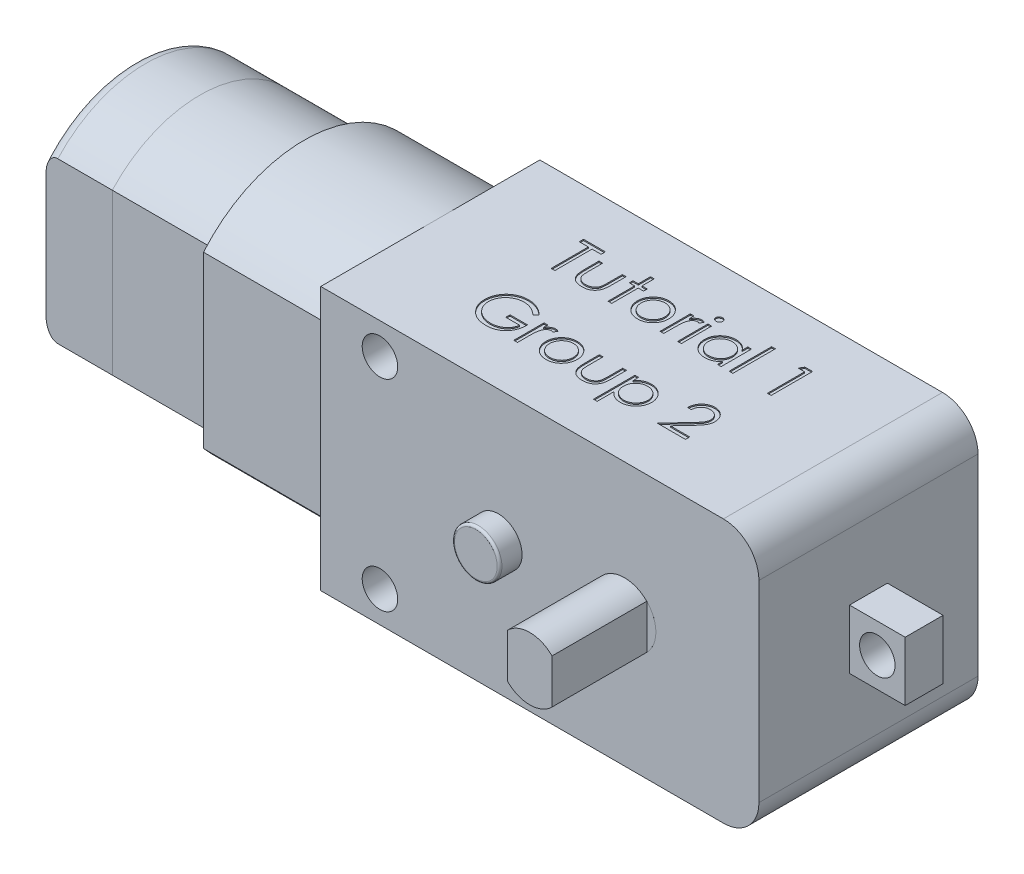
from build123d import *

# Parameters (mm, degrees)
BOSS_EXTRUDE1_DEPTH              = 9.25
BOSS_EXTRUDE1_DEPTH_BACK         = 9.25
BOSS_EXTRUDE2_DEPTH              = 11.4
SKETCH3_W                        = 3.2
SKETCH3_H                        = 5
BOSS_EXTRUDE3_DEPTH              = 4.7
CUT_EXTRUDE1_DEPTH               = 28
CUT_EXTRUDE1_DEPTH_BACK          = 17.7
SKETCH4_R                        = 1.5
SKETCH5_R                        = 2
BOSS_EXTRUDE4_DEPTH              = 1.9
FILLET1_R                        = 0.2
SKETCH6_R                        = 2.65
CUT_EXTRUDE2_DEPTH               = 23.9
BOSS_EXTRUDE5_DEPTH              = 8.8
BOSS_EXTRUDE6_DEPTH              = 5.6
FILLET2_R                        = 1
BOSS_EXTRUDE7_DEPTH              = 1
SKETCH12_R                       = 1
BOSS_EXTRUDE8_DEPTH              = 0.5
SKETCH14_R                       = 1.5
CUT_EXTRUDE3_DEPTH               = 4.2
BOSS_EXTRUDE10_DEPTH             = 17.25
BOSS_EXTRUDE10_DEPTH_BACK        = 17.25
BOSS_EXTRUDE11_REACH             = 52.189
SKETCH16_R                       = 2.65
BOSS_EXTRUDE11_DIRECTION_2_REACH = 52.189
SKETCH19_W                       = 0.314102565
SKETCH19_H                       = 2.557692308
SKETCH19_W_2                     = 0.314102564
SKETCH19_H_2                     = 3.58974359
CUT_EXTRUDE4_DEPTH               = 0.1


with BuildPart() as part:
    # Sketch 1 → Boss-Extrude1 (new, two sides: drawn at the far end of the back side and taken through both)
    with BuildSketch(Plane.XY.offset(-BOSS_EXTRUDE1_DEPTH_BACK)):
        with BuildLine():
            Line((-18.5, -11.125), (15.5, -11.125))
            ThreePointArc((15.5, -11.125), (17.621320344, -10.246320344), (18.5, -8.125))
            Line((18.5, -8.125), (18.5, 8.125))
            ThreePointArc((18.5, 8.125), (17.621320344, 10.246320344), (15.5, 11.125))
            Line((15.5, 11.125), (-18.5, 11.125))
            Line((-18.5, 11.125), (-18.5, -11.125))
        make_face()
    extrude(amount=BOSS_EXTRUDE1_DEPTH + BOSS_EXTRUDE1_DEPTH_BACK)

    # Sketch2 → Boss-Extrude2 (add)
    with BuildSketch(Plane.ZY.offset(18.5)):
        with BuildLine():
            Line((7.75, -7.17743861), (7.75, 7.17743861))
            ThreePointArc((7.75, 7.17743861), (-0.75, 11.125), (-9.25, 7.17743861))
            Line((-9.25, 7.17743861), (-9.25, -7.17743861))
            ThreePointArc((-9.25, -7.17743861), (-0.75, -11.125), (7.75, -7.17743861))
        make_face()
    extrude(amount=BOSS_EXTRUDE2_DEPTH)

    # Sketch3 → Boss-Extrude3 (add)
    with BuildSketch(Plane(origin=(18.5, 0, 0), x_dir=(0, 0, -1), z_dir=(1, 0, 0))):
        Rectangle(SKETCH3_W, SKETCH3_H)
    extrude(amount=BOSS_EXTRUDE3_DEPTH)

    # Sketch4 → Cut-Extrude1 (cut, two sides: drawn at the far end of the back side and taken through both)
    with BuildSketch(Plane.XY.offset(-CUT_EXTRUDE1_DEPTH_BACK)):
        with Locations((-13.5, 8.5)):
            Circle(SKETCH4_R)
        with Locations((-13.5, -8.5)):
            Circle(SKETCH4_R)
    extrude(amount=CUT_EXTRUDE1_DEPTH + CUT_EXTRUDE1_DEPTH_BACK, mode=Mode.SUBTRACT)

    # Sketch5 → Boss-Extrude4 (add)
    with BuildSketch(Plane.XY.offset(9.25)):
        with Locations((-3.5, 0)):
            Circle(SKETCH5_R)
    extrude(amount=BOSS_EXTRUDE4_DEPTH)

    # Fillet1
    fillet1_edges = [part.edges().sort_by_distance(p)[0] for p in [
        (-5.5, 0, 11.15),
    ]]
    fillet(fillet1_edges, radius=FILLET1_R)

    # Sketch6 → Cut-Extrude2 (cut)
    with BuildSketch(Plane.XY.offset(9.25)):
        with Locations((7.15, 0)):
            Circle(SKETCH6_R)
    extrude(amount=-CUT_EXTRUDE2_DEPTH, mode=Mode.SUBTRACT)

    # Sketch14 → Cut-Extrude3 (cut)
    with BuildSketch(Plane.XY.offset(1.6)):
        with Locations((20.85, 0)):
            Circle(SKETCH14_R)
    extrude(amount=-CUT_EXTRUDE3_DEPTH, mode=Mode.SUBTRACT)


with BuildPart() as body_2:
    # Sketch9 → Boss-Extrude5 (new body)
    with BuildSketch(Plane.ZY.offset(29.9)):
        with BuildLine():
            Line((6.65, -6.763181574), (6.65, 6.763181574))
            ThreePointArc((6.65, 6.763181574), (-0.75, 10.025), (-8.15, 6.763181574))
            Line((-8.15, 6.763181574), (-8.15, -6.763181574))
            ThreePointArc((-8.15, -6.763181574), (-0.75, -10.025), (6.65, -6.763181574))
        make_face()
    extrude(amount=BOSS_EXTRUDE5_DEPTH)


with BuildPart() as body_3:
    # Sketch10 → Boss-Extrude6 (new body)
    with BuildSketch(Plane.ZY.offset(38.7)):
        with BuildLine():
            Line((-8.15, 6.763181574), (-8.15, -6.763181574))
            ThreePointArc((-8.15, -6.763181574), (-0.75, -10.025), (6.65, -6.763181574))
            Line((6.65, -6.763181574), (6.65, 6.763181574))
            ThreePointArc((6.65, 6.763181574), (-0.75, 10.025), (-8.15, 6.763181574))
        make_face()
    extrude(amount=BOSS_EXTRUDE6_DEPTH)

    # Fillet2
    fillet2_edges = [body_3.edges().sort_by_distance(p)[0] for p in [
        (-44.3, 10.025, -0.75),
        (-44.3, -10.025, -0.75),
    ]]
    fillet(fillet2_edges, radius=FILLET2_R)


with BuildPart() as body_4:
    # Sketch11 → Boss-Extrude7 (new body)
    with BuildSketch(Plane.ZY.offset(44.3)):
        with BuildLine():
            Line((2.65, 3.666060556), (2.65, -3.666060556))
            ThreePointArc((2.65, -3.666060556), (-5.75, 0), (2.65, 3.666060556))
        make_face()
    extrude(amount=BOSS_EXTRUDE7_DEPTH)


with BuildPart() as body_5:
    # Sketch12 → Boss-Extrude8 (new body)
    with BuildSketch(Plane.ZY.offset(45.3)):
        with Locations((-0.75, 0)):
            Circle(SKETCH12_R)
    extrude(amount=BOSS_EXTRUDE8_DEPTH)


with BuildPart() as body_6:
    # Sketch15 → Boss-Extrude10 (new, two sides: drawn at the far end of the back side and taken through both)
    with BuildSketch(Plane.XY.offset(-BOSS_EXTRUDE10_DEPTH_BACK)):
        with BuildLine():
            Line((9.03, -1.867645577), (9.03, 1.867645577))
            ThreePointArc((9.03, 1.867645577), (7.15, 2.65), (5.27, 1.867645577))
            Line((5.27, 1.867645577), (5.27, -1.867645577))
            ThreePointArc((5.27, -1.867645577), (7.15, -2.65), (9.03, -1.867645577))
        make_face()
    extrude(amount=BOSS_EXTRUDE10_DEPTH + BOSS_EXTRUDE10_DEPTH_BACK)


with BuildPart() as body_7:

    # Boss-Extrude11: up to this face of the body (flat: up to its plane)
    boss_extrude11_end = Plane(part.part.faces().sort_by_distance((0.010664145, 0, 9.25))[0])
    # Sketch16 → Boss-Extrude11 (new, up to the picked face)
    with BuildSketch(Plane.XY, mode=Mode.PRIVATE) as boss_extrude11_sk1:
        with Locations((7.15, 0)):
            Circle(SKETCH16_R)
    boss_extrude11_tool1 = split(extrude(boss_extrude11_sk1.sketch, amount=BOSS_EXTRUDE11_REACH, mode=Mode.PRIVATE), bisect_by=boss_extrude11_end, keep=Keep.BOTH, mode=Mode.PRIVATE)
    add(boss_extrude11_tool1.solids().sort_by(Axis((7.15, 0, 0), (0, 0, 1)))[0])


    # Boss-Extrude11 direction 2: up to this face of the body (flat: up to its plane)
    boss_extrude11_direction_2_end = Plane(part.part.faces().sort_by_distance((-4.220368924, 0, -9.25))[0])
    # Sketch16 → Boss-Extrude11 direction 2 (add, up to the picked face)
    with BuildSketch(Plane.XY, mode=Mode.PRIVATE) as boss_extrude11_direction_2_sk1:
        with Locations((7.15, 0)):
            Circle(SKETCH16_R)
    boss_extrude11_direction_2_tool1 = split(extrude(boss_extrude11_direction_2_sk1.sketch, amount=-BOSS_EXTRUDE11_DIRECTION_2_REACH, mode=Mode.PRIVATE), bisect_by=boss_extrude11_direction_2_end, keep=Keep.BOTH, mode=Mode.PRIVATE)
    add(boss_extrude11_direction_2_tool1.solids().sort_by(Axis((7.15, 0, 0), (0, 0, -1)))[0])


with BuildPart() as part_1:
    add(part.part)

    # Sketch19 → Cut-Extrude4 (cut)
    # profile 1 of 16: a face of its own
    with BuildSketch(Plane(origin=(0, 11.125, 0), x_dir=(1, 0, 0), z_dir=(0, 1, 0))):
        Polygon((-10.853713796, 4.936962188), (-10.853713796, 5.295936547), (-9.013970206, 5.295936547), (-9.013970206, 4.936962188), (-9.776790719, 4.936962188), (-9.776790719, 1.795936547), (-10.090893283, 1.795936547), (-10.090893283, 4.936962188), align=None)
    # profile 2 of 16: a face of its own
    with BuildSketch(Plane(origin=(0, 11.125, 0), x_dir=(1, 0, 0), z_dir=(0, 1, 0))):
        with BuildLine():
            Line((-8.610124052, 4.353628855), (-8.296021488, 4.353628855))
            Line((-8.296021488, 4.353628855), (-8.296021488, 3.167330778))
            add(Edge.make_bspline(
                [(-8.296021488, 3.167330778), (-8.295879583, 3.132508029), (-8.295608126, 3.065893741), (-8.293767185, 2.970038554), (-8.289437091, 2.882621842), (-8.284023267, 2.803593105), (-8.277061131, 2.732965713), (-8.26877777, 2.670986356), (-8.259519349, 2.616952172), (-8.250456635, 2.584408816), (-8.246241841, 2.569273887)],
                knots=[0, 0, 0, 0, 1.388932606, 2.656963016, 3.823490214, 4.879454478, 5.816252168, 6.653371382, 7.373723809, 8, 8, 8, 8], degree=3))
            add(Edge.make_bspline(
                [(-8.246241841, 2.569273887), (-8.239480386, 2.550251016), (-8.226098045, 2.512600755), (-8.201824561, 2.45821175), (-8.171796224, 2.407836467), (-8.138936396, 2.359532395), (-8.101036989, 2.314730408), (-8.058577518, 2.273506164), (-8.012979281, 2.234302073), (-7.945224257, 2.187917281), (-7.852564991, 2.138201951), (-7.730912236, 2.095306132), (-7.59900801, 2.069670312), (-7.507843291, 2.066696057), (-7.46098543, 2.065167317)],
                knots=[0, 0, 0, 0, 0.725840625, 1.436591201, 2.137033971, 2.831655856, 3.53531722, 4.242432219, 4.957935707, 5.694543706, 7.190802206, 8.724350549, 10.316345118, 12, 12, 12, 12], degree=3))
            add(Edge.make_bspline(
                [(-7.46098543, 2.065167317), (-7.414131923, 2.066728565), (-7.323479054, 2.069749292), (-7.193024085, 2.094532831), (-7.073772671, 2.13593852), (-6.966921719, 2.193745932), (-6.872955879, 2.264487995), (-6.794651461, 2.347496803), (-6.730044206, 2.44014619), (-6.701834785, 2.509270469), (-6.687648091, 2.544033503)],
                knots=[0, 0, 0, 0, 1.157059328, 2.238695713, 3.266970494, 4.264342957, 5.228770407, 6.160125903, 7.074715775, 8, 8, 8, 8], degree=3))
            add(Edge.make_bspline(
                [(-6.687648091, 2.544033503), (-6.683453861, 2.557999801), (-6.674181442, 2.588875877), (-6.664219091, 2.641255625), (-6.655244629, 2.70372023), (-6.647581453, 2.776678438), (-6.64211629, 2.859939591), (-6.639170264, 2.953477667), (-6.635841989, 3.056999027), (-6.635791472, 3.129466786), (-6.635765078, 3.167330778)],
                knots=[0, 0, 0, 0, 0.557542046, 1.232589297, 2.036731608, 2.971723315, 4.038036528, 5.22795436, 6.551621927, 8, 8, 8, 8], degree=3))
            Line((-6.635765078, 3.167330778), (-6.635765078, 4.353628855))
            Line((-6.635765078, 4.353628855), (-6.321662514, 4.353628855))
            Line((-6.321662514, 4.353628855), (-6.321662514, 3.108436547))
            add(Edge.make_bspline(
                [(-6.321662514, 3.108436547), (-6.322104209, 3.066129376), (-6.322961157, 2.984047676), (-6.3284685, 2.864763565), (-6.337918113, 2.75360132), (-6.352260798, 2.6505021), (-6.369126473, 2.555544618), (-6.390882746, 2.468607172), (-6.416860983, 2.389957618), (-6.446166498, 2.318215841), (-6.480788366, 2.253168947), (-6.517615386, 2.19143313), (-6.560140158, 2.134540195), (-6.604910393, 2.079658058), (-6.654712048, 2.029516531), (-6.708611907, 1.982965055), (-6.765851327, 1.939292023), (-6.827700525, 1.900200744), (-6.893256588, 1.864984098), (-6.962600445, 1.83376802), (-7.036581443, 1.809065443), (-7.11424508, 1.787754777), (-7.19597186, 1.771040308), (-7.281682993, 1.759253742), (-7.371349609, 1.752028411), (-7.432459069, 1.751391366), (-7.463789918, 1.751064753)],
                knots=[0, 0, 0, 0, 1.493040784, 2.896703357, 4.213163133, 5.428574705, 6.569057535, 7.615249723, 8.588095153, 9.490268104, 10.346124644, 11.18633936, 12.024365274, 12.850166724, 13.684164916, 14.514361689, 15.362232829, 16.222528818, 17.093394965, 17.986930858, 18.902426812, 19.842810585, 20.827885679, 21.843828298, 22.894529745, 24, 24, 24, 24], degree=3))
            add(Edge.make_bspline(
                [(-7.463789918, 1.751064753), (-7.494886432, 1.75140446), (-7.555993977, 1.752072016), (-7.645665221, 1.759213824), (-7.731613827, 1.771021994), (-7.813534226, 1.787877212), (-7.891508623, 1.808916282), (-7.965852863, 1.833919817), (-8.035696426, 1.865000299), (-8.10187843, 1.899977856), (-8.163880818, 1.939543132), (-8.221989396, 1.982911171), (-8.276126249, 2.030017234), (-8.326303317, 2.080664591), (-8.371816294, 2.135481528), (-8.413232335, 2.194027088), (-8.45118904, 2.255721177), (-8.485541831, 2.321784339), (-8.515053586, 2.394356349), (-8.541108832, 2.474653446), (-8.562419471, 2.563555963), (-8.579761939, 2.660987891), (-8.593713379, 2.766482933), (-8.603399522, 2.880651348), (-8.608815352, 3.00321504), (-8.609678414, 3.08786493), (-8.610124052, 3.131573567)],
                knots=[0, 0, 0, 0, 1.083640291, 2.129454052, 3.13281866, 4.105697902, 5.042300162, 5.946461698, 6.836384745, 7.703652036, 8.553297018, 9.397182691, 10.228592656, 11.052265423, 11.879314572, 12.708807002, 13.549817954, 14.402308542, 15.300838682, 16.27712199, 17.341985831, 18.484375296, 19.725102775, 21.0496083, 22.476576903, 24, 24, 24, 24], degree=3))
            Line((-8.610124052, 3.131573567), (-8.610124052, 4.353628855))
        make_face()
    # profile 3 of 16: a face of its own
    with BuildSketch(Plane(origin=(0, 11.125, 0), x_dir=(1, 0, 0), z_dir=(0, 1, 0))):
        Polygon((-5.289611232, 5.385680137), (-4.975508668, 5.385680137), (-4.975508668, 4.353628855), (-4.526790719, 4.353628855), (-4.526790719, 4.039526291), (-4.975508668, 4.039526291), (-4.975508668, 1.795936547), (-5.289611232, 1.795936547), (-5.289611232, 4.039526291), (-5.73832918, 4.039526291), (-5.73832918, 4.353628855), (-5.289611232, 4.353628855), align=None)
    # profile 4 of 16: a face of its own
    with BuildSketch(Plane(origin=(0, 11.125, 0), x_dir=(1, 0, 0), z_dir=(0, 1, 0))):
        with BuildLine():
            add(Edge.make_bspline(
                [(-2.752952578, 4.39850065), (-2.704961305, 4.397478759), (-2.610862147, 4.39547508), (-2.473054262, 4.374060114), (-2.341509126, 4.34131275), (-2.215722934, 4.296041188), (-2.097306638, 4.235359237), (-1.984535394, 4.162949946), (-1.877718385, 4.077167353), (-1.813695356, 4.010809284), (-1.78119777, 3.977126451)],
                knots=[0, 0, 0, 0, 1.054011418, 2.066658804, 3.057071809, 4.030435133, 4.997543892, 5.974964718, 6.972108034, 8, 8, 8, 8], degree=3))
            add(Edge.make_bspline(
                [(-1.78119777, 3.977126451), (-1.753215816, 3.944912465), (-1.697793436, 3.881107923), (-1.626727717, 3.77765231), (-1.565506157, 3.67051221), (-1.516443196, 3.558264883), (-1.477758172, 3.441890212), (-1.450292476, 3.320988201), (-1.433955541, 3.195825854), (-1.431752574, 3.110822015), (-1.430636873, 3.067771483)],
                knots=[0, 0, 0, 0, 1.025258237, 2.030674902, 3.01204498, 3.988269485, 4.97094183, 5.956517959, 6.965070386, 8, 8, 8, 8], degree=3))
            add(Edge.make_bspline(
                [(-1.430636873, 3.067771483), (-1.43161821, 3.024471426), (-1.433557378, 2.938908492), (-1.451900995, 2.812889127), (-1.480432081, 2.690694304), (-1.521263919, 2.57283561), (-1.573622028, 2.458952783), (-1.637512716, 2.349543233), (-1.713384333, 2.2443911), (-1.79938833, 2.144389262), (-1.894440206, 2.052223047), (-1.997556354, 1.971894778), (-2.106710388, 1.903073253), (-2.223353741, 1.847636838), (-2.346421228, 1.803927137), (-2.476178296, 1.773227121), (-2.612423366, 1.754665437), (-2.705450588, 1.752281864), (-2.752952578, 1.751064753)],
                knots=[0, 0, 0, 0, 0.998656419, 1.973391657, 2.932242238, 3.890759089, 4.846373663, 5.82037756, 6.809684879, 7.83454468, 8.860553229, 9.859544525, 10.845671541, 11.83227036, 12.833544569, 13.85385346, 14.904124723, 16, 16, 16, 16], degree=3))
            add(Edge.make_bspline(
                [(-2.752952578, 1.751064753), (-2.800687297, 1.752285949), (-2.894178157, 1.754677723), (-3.030904139, 1.773155006), (-3.160893758, 1.803912989), (-3.284122357, 1.847780481), (-3.401267203, 1.903075025), (-3.5110537, 1.971686715), (-3.614253616, 2.05224687), (-3.7093256, 2.144382807), (-3.795324206, 2.244392763), (-3.871197214, 2.349542802), (-3.93508754, 2.458952895), (-3.987445744, 2.57283558), (-4.028277557, 2.690694312), (-4.05680865, 2.812889124), (-4.075152264, 2.938908493), (-4.077091433, 3.024471426), (-4.07807277, 3.067771483)],
                knots=[0, 0, 0, 0, 1.099876186, 2.154163076, 3.173186993, 4.173200201, 5.163417411, 6.152872554, 7.150605724, 8.17532212, 9.198891216, 10.186952605, 11.159729845, 12.11414092, 13.071450619, 14.029093627, 15.002601286, 16, 16, 16, 16], degree=3))
            add(Edge.make_bspline(
                [(-4.07807277, 3.067771483), (-4.07694946, 3.110588029), (-4.074725498, 3.195357432), (-4.058404989, 3.320284492), (-4.031046433, 3.440981881), (-3.992315036, 3.556907357), (-3.942799845, 3.668662793), (-3.882438558, 3.776067624), (-3.810647925, 3.879055425), (-3.755445973, 3.942777505), (-3.727511873, 3.975023086)],
                knots=[0, 0, 0, 0, 1.031353054, 2.041901799, 3.029428768, 4.008703097, 4.981709435, 5.96992636, 6.972712378, 8, 8, 8, 8], degree=3))
            add(Edge.make_bspline(
                [(-3.727511873, 3.975023086), (-3.695063282, 4.008998025), (-3.631247418, 4.075815721), (-3.52389869, 4.161348245), (-3.411404869, 4.235264319), (-3.291679943, 4.294740535), (-3.165997085, 4.341579052), (-3.033777842, 4.374144568), (-2.895502327, 4.395397923), (-2.800942706, 4.3974561), (-2.752952578, 4.39850065)],
                knots=[0, 0, 0, 0, 1.027980169, 2.021703884, 2.998553061, 3.971491411, 4.943284454, 5.930300938, 6.949603206, 8, 8, 8, 8], degree=3))
        make_face()
        with BuildLine():
            add(Edge.make_bspline(
                [(-2.754354821, 4.084398086), (-2.788292433, 4.083433494), (-2.855291561, 4.081529212), (-2.953911146, 4.067045307), (-3.0488513, 4.044097803), (-3.140292144, 4.011493747), (-3.227925317, 3.969394848), (-3.311834719, 3.917686487), (-3.392267159, 3.857053531), (-3.467649222, 3.787590859), (-3.536831534, 3.711711865), (-3.597309511, 3.630863506), (-3.648734617, 3.54635716), (-3.691574776, 3.458104949), (-3.723481964, 3.365212535), (-3.746654987, 3.268731903), (-3.761125227, 3.168466487), (-3.763011606, 3.100305469), (-3.763970206, 3.065668118)],
                knots=[0, 0, 0, 0, 1.021534396, 2.016698045, 2.994645724, 3.958388632, 4.93408049, 5.916473867, 6.921342795, 7.962252576, 8.998418191, 10.008913653, 10.997312074, 11.973003931, 12.956656626, 13.948281152, 14.957379055, 16, 16, 16, 16], degree=3))
            add(Edge.make_bspline(
                [(-3.763970206, 3.065668118), (-3.762363382, 3.020916091), (-3.759174138, 2.932091685), (-3.733238902, 2.801280563), (-3.689852622, 2.67569871), (-3.631265342, 2.556082324), (-3.557859123, 2.445410046), (-3.471372057, 2.346738562), (-3.372732356, 2.261552751), (-3.263115856, 2.190871905), (-3.144761538, 2.134712149), (-3.019505217, 2.094913174), (-2.888864523, 2.069041481), (-2.799583792, 2.066470007), (-2.754354821, 2.065167317)],
                knots=[0, 0, 0, 0, 1.016792936, 2.018143844, 3.017858371, 4.030088057, 5.03801393, 6.028138512, 7.003788237, 7.991172063, 8.984598303, 9.972568034, 10.972917682, 12, 12, 12, 12], degree=3))
            add(Edge.make_bspline(
                [(-2.754354821, 2.065167317), (-2.709128453, 2.066477597), (-2.619852857, 2.069064054), (-2.48939368, 2.094782873), (-2.364479708, 2.134886534), (-2.24624832, 2.190808744), (-2.136681717, 2.261821159), (-2.037332596, 2.346257536), (-1.951583984, 2.445671387), (-1.87825038, 2.556228916), (-1.818703637, 2.675513268), (-1.775520435, 2.80130374), (-1.749522849, 2.932085782), (-1.74634202, 3.020914113), (-1.744739437, 3.065668118)],
                knots=[0, 0, 0, 0, 1.02726834, 2.027799167, 3.010890988, 4.004497153, 4.992059811, 5.971914811, 6.958719428, 7.966827853, 8.981595046, 9.981490638, 10.983022906, 12, 12, 12, 12], degree=3))
            add(Edge.make_bspline(
                [(-1.744739437, 3.065668118), (-1.745697707, 3.100305676), (-1.747583436, 3.168467101), (-1.7620584, 3.268729555), (-1.78521394, 3.365221152), (-1.817185557, 3.458073155), (-1.859839571, 3.546585659), (-1.912256364, 3.630615386), (-1.97248739, 3.711991932), (-2.042504511, 3.787345573), (-2.117807888, 3.85708061), (-2.198272927, 3.917709999), (-2.282057905, 3.969167594), (-2.369436488, 4.011853835), (-2.460889055, 4.043801175), (-2.555696185, 4.067177807), (-2.653894995, 4.081468004), (-2.720654038, 4.083415145), (-2.754354821, 4.084398086)],
                knots=[0, 0, 0, 0, 1.042956736, 2.052379634, 3.044323526, 4.02829302, 5.004299113, 5.996692471, 7.007513377, 8.048758398, 9.090003419, 10.095195979, 11.07790575, 12.047570684, 13.018257071, 13.989683339, 14.985167495, 16, 16, 16, 16], degree=3))
        make_face(mode=Mode.SUBTRACT)
    # profile 5 of 16: a face of its own
    with BuildSketch(Plane(origin=(0, 11.125, 0), x_dir=(1, 0, 0), z_dir=(0, 1, 0))):
        with BuildLine():
            Line((-0.892175334, 4.353628855), (-0.57807277, 4.353628855))
            Line((-0.57807277, 4.353628855), (-0.57807277, 3.977126451))
            add(Edge.make_bspline(
                [(-0.57807277, 3.977126451), (-0.554884011, 4.01218228), (-0.510535691, 4.079226279), (-0.436822761, 4.16789558), (-0.36131943, 4.241310626), (-0.283664243, 4.299814145), (-0.203286143, 4.343627264), (-0.121949191, 4.375720299), (-0.038373721, 4.394697614), (0.017788203, 4.397231273), (0.045925627, 4.39850065)],
                knots=[0, 0, 0, 0, 1.2804753, 2.448899062, 3.506932113, 4.484331642, 5.4025378, 6.288909075, 7.142734305, 8, 8, 8, 8], degree=3))
            add(Edge.make_bspline(
                [(0.045925627, 4.39850065), (0.067751954, 4.397310123), (0.112661039, 4.394860538), (0.180643629, 4.377649713), (0.250687081, 4.35017169), (0.295829468, 4.324331468), (0.319363127, 4.310860426)],
                knots=[0, 0, 0, 0, 0.901110191, 1.854092781, 2.881294221, 4, 4, 4, 4], degree=3))
            Line((0.319363127, 4.310860426), (0.146887166, 4.038825169))
            add(Edge.make_bspline(
                [(0.146887166, 4.038825169), (0.131778145, 4.045565435), (0.10309833, 4.058359751), (0.061143764, 4.073501761), (0.022462427, 4.082417677), (-0.002181131, 4.083768394), (-0.013669725, 4.084398086)],
                knots=[0, 0, 0, 0, 1.180555205, 2.24091978, 3.179933427, 4, 4, 4, 4], degree=3))
            add(Edge.make_bspline(
                [(-0.013669725, 4.084398086), (-0.038875459, 4.082718049), (-0.090287849, 4.079291259), (-0.165772348, 4.052352451), (-0.239019554, 4.008827211), (-0.297191216, 3.9605561), (-0.342233469, 3.914008302), (-0.374373694, 3.873359899), (-0.403856441, 3.827781268), (-0.432026662, 3.778051584), (-0.457692956, 3.723321738), (-0.481647625, 3.664138525), (-0.503306488, 3.600433396), (-0.515656732, 3.556050876), (-0.521983027, 3.533316355)],
                knots=[0, 0, 0, 0, 1.125678352, 2.296057538, 3.5422874, 4.923748041, 5.663163013, 6.437101912, 7.23742474, 8.08941207, 8.991984279, 9.93940061, 10.944477711, 12, 12, 12, 12], degree=3))
            add(Edge.make_bspline(
                [(-0.521983027, 3.533316355), (-0.52671542, 3.513039182), (-0.537197312, 3.468126783), (-0.54738885, 3.392778258), (-0.557458367, 3.303754599), (-0.564554986, 3.200808007), (-0.571133028, 3.084195563), (-0.57484311, 2.953739617), (-0.577946251, 2.809306266), (-0.578029318, 2.708331913), (-0.57807277, 2.655511868)],
                knots=[0, 0, 0, 0, 0.566838948, 1.255505196, 2.06880316, 3.007127437, 4.065329342, 5.249902469, 6.561414163, 8, 8, 8, 8], degree=3))
            Line((-0.57807277, 2.655511868), (-0.57807277, 1.795936547))
            Line((-0.57807277, 1.795936547), (-0.892175334, 1.795936547))
            Line((-0.892175334, 1.795936547), (-0.892175334, 4.353628855))
        make_face()
    # profile 6 of 16: a face of its own
    with BuildSketch(Plane(origin=(0, 11.125, 0), x_dir=(1, 0, 0), z_dir=(0, 1, 0))):
        with BuildLine():
            add(Edge.make_bspline(
                [(0.744242935, 5.430551932), (0.763734251, 5.42964778), (0.801901991, 5.427877276), (0.857095258, 5.412715799), (0.90735227, 5.387016113), (0.951930003, 5.352536432), (0.99018189, 5.311986989), (1.0169626, 5.26472602), (1.034174996, 5.213667382), (1.036253552, 5.178052292), (1.037311845, 5.159918919)],
                knots=[0, 0, 0, 0, 1.055194115, 2.066272739, 3.074728998, 4.095836921, 5.109056067, 6.073838105, 7.019297344, 8, 8, 8, 8], degree=3))
            add(Edge.make_bspline(
                [(1.037311845, 5.159918919), (1.036229685, 5.142256266), (1.034090383, 5.107339291), (1.016975895, 5.057165819), (0.989953657, 5.010561535), (0.951954532, 4.970090825), (0.907345771, 4.935630205), (0.857096985, 4.909925466), (0.801901536, 4.894765329), (0.763734097, 4.89299464), (0.744242935, 4.892090394)],
                knots=[0, 0, 0, 0, 0.96129708, 1.900370562, 2.859976407, 3.87933698, 4.906634145, 5.921202961, 6.938410037, 8, 8, 8, 8], degree=3))
            add(Edge.make_bspline(
                [(0.744242935, 4.892090394), (0.72497466, 4.892960114), (0.68747148, 4.894652911), (0.633104637, 4.910222928), (0.583276148, 4.935639001), (0.538611475, 4.969865186), (0.501381282, 5.010810084), (0.474282957, 5.057137378), (0.457207995, 5.107346532), (0.455063366, 5.142258699), (0.453978512, 5.159918919)],
                knots=[0, 0, 0, 0, 1.054934014, 2.053291228, 3.073705704, 4.106921865, 5.123545215, 6.088680038, 7.033164197, 8, 8, 8, 8], degree=3))
            add(Edge.make_bspline(
                [(0.453978512, 5.159918919), (0.455039598, 5.178049769), (0.45712364, 5.213659901), (0.474295756, 5.264754934), (0.501155563, 5.311736436), (0.538636127, 5.352761936), (0.583269587, 5.38700737), (0.633106332, 5.412418352), (0.687471032, 5.427989691), (0.724974508, 5.429682306), (0.744242935, 5.430551932)],
                knots=[0, 0, 0, 0, 0.98631895, 1.937192651, 2.907499808, 3.917963147, 4.944918757, 5.95915025, 6.951458133, 8, 8, 8, 8], degree=3))
        make_face()
    # profile 7 of 16: a face of its own
    with BuildSketch(Plane(origin=(0, 11.125, 0), x_dir=(1, 0, 0), z_dir=(0, 1, 0))):
        with Locations((0.745645179, 3.074782701)):
            Rectangle(SKETCH19_W, SKETCH19_H)
    # profile 8 of 16: a face of its own
    with BuildSketch(Plane(origin=(0, 11.125, 0), x_dir=(1, 0, 0), z_dir=(0, 1, 0))):
        with BuildLine():
            Line((4.268081076, 4.353628855), (4.268081076, 1.795936547))
            Line((4.268081076, 1.795936547), (3.953978512, 1.795936547))
            Line((3.953978512, 1.795936547), (3.953978512, 2.2383444))
            add(Edge.make_bspline(
                [(3.953978512, 2.2383444), (3.918559721, 2.198304806), (3.849439506, 2.120167035), (3.733998388, 2.018084862), (3.61163021, 1.933706541), (3.482928889, 1.865556625), (3.348010646, 1.814364569), (3.207174558, 1.77797841), (3.060363177, 1.754584575), (2.960110823, 1.752248553), (2.909307037, 1.751064753)],
                knots=[0, 0, 0, 0, 1.074387032, 2.096679803, 3.090159297, 4.057316773, 5.018401886, 5.985159533, 6.978961417, 8, 8, 8, 8], degree=3))
            add(Edge.make_bspline(
                [(2.909307037, 1.751064753), (2.864139084, 1.752291125), (2.775065879, 1.754709585), (2.644036802, 1.773471889), (2.517944552, 1.80360251), (2.39666998, 1.8455034), (2.280997834, 1.901084222), (2.169937737, 1.96762547), (2.064065045, 2.0468663), (1.964993506, 2.137454328), (1.873761506, 2.235849315), (1.793700233, 2.340794862), (1.726947154, 2.451837166), (1.671127073, 2.56757032), (1.628130728, 2.688885239), (1.598157094, 2.815362407), (1.579416647, 2.946852281), (1.576999187, 3.036391804), (1.575773384, 3.081793919)],
                knots=[0, 0, 0, 0, 1.033919861, 2.038935746, 3.024066025, 3.998881131, 4.97069526, 5.957263378, 6.95902576, 7.993208707, 9.027059324, 10.027763471, 11.009749337, 11.988697705, 12.965288445, 13.950418724, 14.960734635, 16, 16, 16, 16], degree=3))
            add(Edge.make_bspline(
                [(1.575773384, 3.081793919), (1.577026355, 3.126257623), (1.579503412, 3.214159966), (1.597956632, 3.343438664), (1.62898764, 3.467956925), (1.672535488, 3.587313868), (1.728377443, 3.701653918), (1.79630553, 3.811057943), (1.876324655, 3.915827341), (1.968577062, 4.013498567), (2.068511832, 4.103719182), (2.175420563, 4.182128227), (2.286643844, 4.249845076), (2.403906855, 4.303498552), (2.525473959, 4.346907657), (2.652427405, 4.376940625), (2.784238984, 4.394637946), (2.873729476, 4.39720071), (2.919122743, 4.39850065)],
                knots=[0, 0, 0, 0, 1.020392517, 2.01726096, 2.990465484, 3.961182959, 4.928053699, 5.906110375, 6.912531644, 7.948652711, 8.985773172, 9.998621852, 10.987621588, 11.969261332, 12.953316658, 13.946091881, 14.958173133, 16, 16, 16, 16], degree=3))
            add(Edge.make_bspline(
                [(2.919122743, 4.39850065), (2.971322602, 4.397062898), (3.073684062, 4.394243536), (3.223412071, 4.370780808), (3.365056549, 4.331142341), (3.499710901, 4.277224843), (3.626891587, 4.205576114), (3.745394571, 4.115196153), (3.856460055, 4.006654966), (3.920840346, 3.923284521), (3.953978512, 3.880371644)],
                knots=[0, 0, 0, 0, 1.038897134, 2.037228247, 3.008116434, 3.962042015, 4.918381754, 5.904844433, 6.921570401, 8, 8, 8, 8], degree=3))
            Line((3.953978512, 3.880371644), (3.953978512, 4.353628855))
            Line((3.953978512, 4.353628855), (4.268081076, 4.353628855))
        make_face()
        with BuildLine():
            add(Edge.make_bspline(
                [(2.923329473, 4.084398086), (2.877415136, 4.082764448), (2.786787536, 4.079539907), (2.653743533, 4.054366412), (2.526430119, 4.012481818), (2.405484045, 3.955199916), (2.292815829, 3.88317118), (2.192122158, 3.796049796), (2.102579456, 3.696212782), (2.027271192, 3.584110672), (1.965880695, 3.463932581), (1.922713663, 3.338308143), (1.894244416, 3.209503165), (1.891335895, 3.122140479), (1.889875948, 3.07828831)],
                knots=[0, 0, 0, 0, 1.031046209, 2.035121221, 3.029706178, 4.034933723, 5.034054252, 6.02443088, 7.017295772, 8.038157696, 9.050218397, 10.03989886, 11.016116709, 12, 12, 12, 12], degree=3))
            add(Edge.make_bspline(
                [(1.889875948, 3.07828831), (1.891740841, 3.034698203), (1.895463318, 2.947688847), (1.922214012, 2.81870827), (1.967093886, 2.693054228), (2.028335948, 2.571793235), (2.105022573, 2.459209134), (2.193911226, 2.357469012), (2.295861507, 2.269979424), (2.408789014, 2.19674185), (2.529396985, 2.137579329), (2.656230916, 2.09641369), (2.786906554, 2.069835909), (2.875758888, 2.066731432), (2.920524986, 2.065167317)],
                knots=[0, 0, 0, 0, 0.979072187, 1.954306742, 2.945804271, 3.96968567, 4.997920485, 5.998718438, 6.996577872, 8.005894225, 9.015743152, 10.005417472, 10.995077863, 12, 12, 12, 12], degree=3))
            add(Edge.make_bspline(
                [(2.920524986, 2.065167317), (2.965971489, 2.066827281), (3.056360075, 2.070128784), (3.189798783, 2.095410049), (3.319293746, 2.137178848), (3.443080975, 2.195077975), (3.558397106, 2.26683533), (3.661894983, 2.350842421), (3.749410952, 2.448545606), (3.823603561, 2.555922059), (3.881778978, 2.673634055), (3.924155037, 2.798968246), (3.949208943, 2.931928994), (3.952366673, 3.022792921), (3.953978512, 3.069173727)],
                knots=[0, 0, 0, 0, 1.01762866, 2.023962475, 3.030623092, 4.058876274, 5.077231937, 6.066672613, 7.034107872, 8.005628644, 8.981990164, 9.965428785, 10.961468474, 12, 12, 12, 12], degree=3))
            add(Edge.make_bspline(
                [(3.953978512, 3.069173727), (3.953018855, 3.104511557), (3.951129948, 3.174067591), (3.936699379, 3.276195108), (3.913744452, 3.373928834), (3.881398282, 3.467371523), (3.838906998, 3.556006539), (3.787659232, 3.640470299), (3.726753782, 3.72032351), (3.657171086, 3.794466581), (3.581005883, 3.862093044), (3.500411343, 3.922457284), (3.414432596, 3.972046057), (3.324515559, 4.013087329), (3.230504224, 4.045746478), (3.131633605, 4.067534172), (3.028954618, 4.082494493), (2.958908562, 4.083756874), (2.923329473, 4.084398086)],
                knots=[0, 0, 0, 0, 1.050140795, 2.067009409, 3.05949893, 4.030605086, 5.00011959, 5.97591094, 6.962425594, 7.979863591, 8.993523472, 9.986985069, 10.967611495, 11.937549037, 12.921786183, 13.919465291, 14.943216303, 16, 16, 16, 16], degree=3))
        make_face(mode=Mode.SUBTRACT)
    # profile 9 of 16: a face of its own
    with BuildSketch(Plane(origin=(0, 11.125, 0), x_dir=(1, 0, 0), z_dir=(0, 1, 0))):
        with Locations((5.098209281, 3.590808342)):
            Rectangle(SKETCH19_W_2, SKETCH19_H_2)
    # profile 10 of 16: a face of its own
    with BuildSketch(Plane(origin=(0, 11.125, 0), x_dir=(1, 0, 0), z_dir=(0, 1, 0))):
        Polygon((7.838894377, 5.295936547), (8.486029794, 5.295936547), (8.486029794, 1.795936547), (8.17192723, 1.795936547), (8.17192723, 4.936962188), (7.633465691, 4.936962188), align=None)
    # profile 11 of 16: a face of its own
    with BuildSketch(Plane(origin=(0, 11.125, 0), x_dir=(1, 0, 0), z_dir=(0, 1, 0))):
        with BuildLine():
            Line((-7.174226616, -2.134752555), (-7.443457386, -2.389960888))
            add(Edge.make_bspline(
                [(-7.443457386, -2.389960888), (-7.492176274, -2.344130025), (-7.58845232, -2.253561163), (-7.745412563, -2.136050167), (-7.909176197, -2.035384067), (-8.078888694, -1.953477831), (-8.250347248, -1.88812507), (-8.421276024, -1.84159693), (-8.589921725, -1.811924393), (-8.702088944, -1.808376023), (-8.757359629, -1.806627555)],
                knots=[0, 0, 0, 0, 1.08915593, 2.152340314, 3.188132944, 4.216796309, 5.218260357, 6.173443236, 7.099959455, 8, 8, 8, 8], degree=3))
            add(Edge.make_bspline(
                [(-8.757359629, -1.806627555), (-8.791274329, -1.807041161), (-8.85901577, -1.8078673), (-8.959637714, -1.818411515), (-9.059204351, -1.833576379), (-9.157527726, -1.855518257), (-9.254799012, -1.883327317), (-9.350679904, -1.91811278), (-9.445349259, -1.958668024), (-9.53791534, -2.005530498), (-9.627655843, -2.057010344), (-9.712412679, -2.114058885), (-9.792726078, -2.174847675), (-9.867086503, -2.240898654), (-9.93592169, -2.31161352), (-10.000870062, -2.385676826), (-10.059647358, -2.465112044), (-10.112738523, -2.54845767), (-10.160100141, -2.63424986), (-10.201908795, -2.721662849), (-10.237005883, -2.810406704), (-10.264775338, -2.900592781), (-10.287685992, -2.991523371), (-10.303803599, -3.083828092), (-10.312890321, -3.177605777), (-10.314462101, -3.240403035), (-10.315252257, -3.271972106)],
                knots=[0, 0, 0, 0, 1.02818874, 2.053710826, 3.065248034, 4.081641283, 5.106893873, 6.131558223, 7.173050175, 8.228653731, 9.27666206, 10.308777013, 11.325269123, 12.329503258, 13.32196095, 14.316845687, 15.314881793, 16.315733098, 17.311955233, 18.285320748, 19.252783886, 20.203351036, 21.145449891, 22.095197417, 23.042428769, 24, 24, 24, 24], degree=3))
            add(Edge.make_bspline(
                [(-10.315252257, -3.271972106), (-10.314496539, -3.304242924), (-10.312987166, -3.368696437), (-10.303326847, -3.46489051), (-10.285398606, -3.559655912), (-10.261430897, -3.653304045), (-10.231450082, -3.745995293), (-10.194077416, -3.837327803), (-10.149811815, -3.927298194), (-10.098575263, -4.015095811), (-10.04238906, -4.100618835), (-9.979445979, -4.181178356), (-9.912585395, -4.257847134), (-9.839371495, -4.328922897), (-9.762151953, -4.396306794), (-9.678619677, -4.458142316), (-9.590417217, -4.515620539), (-9.497410005, -4.568017058), (-9.400607222, -4.614825594), (-9.301350469, -4.65644949), (-9.199322654, -4.690728827), (-9.095059964, -4.718666931), (-8.988686692, -4.741567229), (-8.87966289, -4.756299709), (-8.768790181, -4.76699054), (-8.694051549, -4.76777221), (-8.656398091, -4.768166017)],
                knots=[0, 0, 0, 0, 0.93586088, 1.869166235, 2.799637598, 3.729985548, 4.670839027, 5.622275134, 6.589130586, 7.576015415, 8.568469353, 9.55398029, 10.53834874, 11.515998671, 12.510579167, 13.508179873, 14.527009472, 15.561807829, 16.601455013, 17.643573243, 18.680854198, 19.719860599, 20.772568776, 21.833555941, 22.908541556, 24, 24, 24, 24], degree=3))
            add(Edge.make_bspline(
                [(-8.656398091, -4.768166017), (-8.611019743, -4.76721744), (-8.521911986, -4.765354757), (-8.390925544, -4.750854467), (-8.265122473, -4.728207674), (-8.14485627, -4.695041777), (-8.029987249, -4.652738102), (-7.920094307, -4.601742715), (-7.816042649, -4.540099656), (-7.717519475, -4.470525789), (-7.62676229, -4.393010957), (-7.544908166, -4.309366502), (-7.473262677, -4.219998435), (-7.410757977, -4.12543312), (-7.359049323, -4.024887815), (-7.316606528, -3.918855252), (-7.284073236, -3.80728774), (-7.270718261, -3.730196109), (-7.263970206, -3.69124294)],
                knots=[0, 0, 0, 0, 1.13008108, 2.219097802, 3.278683437, 4.311054135, 5.322181354, 6.324827112, 7.324222904, 8.330512327, 9.32562643, 10.293043162, 11.24128371, 12.174520618, 13.111833804, 14.052305215, 15.015860969, 16, 16, 16, 16], degree=3))
            Line((-7.263970206, -3.69124294), (-8.430636873, -3.69124294))
            Line((-8.430636873, -3.69124294), (-8.430636873, -3.332268581))
            Line((-8.430636873, -3.332268581), (-6.949867642, -3.332268581))
            add(Edge.make_bspline(
                [(-6.949867642, -3.332268581), (-6.95157349, -3.39917607), (-6.954912144, -3.530126111), (-6.978331059, -3.721096382), (-7.016147572, -3.901468076), (-7.067807884, -4.071431147), (-7.134683164, -4.23074474), (-7.216055692, -4.379570606), (-7.313227813, -4.516947287), (-7.422738255, -4.643996291), (-7.545638213, -4.757325503), (-7.678606833, -4.856931441), (-7.821863801, -4.940834056), (-7.975273609, -5.009094718), (-8.138334042, -5.062368713), (-8.311422422, -5.10014029), (-8.494304022, -5.122770253), (-8.619640699, -5.125661633), (-8.683741841, -5.127140376)],
                knots=[0, 0, 0, 0, 1.140356446, 2.231883559, 3.274166699, 4.278491846, 5.25512956, 6.21435461, 7.1637429, 8.11826594, 9.068280886, 10.0076534, 10.945064095, 11.891975133, 12.864533718, 13.863980011, 14.907571808, 16, 16, 16, 16], degree=3))
            add(Edge.make_bspline(
                [(-8.683741841, -5.127140376), (-8.723251976, -5.126571254), (-8.801178697, -5.125448764), (-8.916269625, -5.117471417), (-9.028187246, -5.10519084), (-9.136915254, -5.086645717), (-9.242853597, -5.063931063), (-9.345473182, -5.034844344), (-9.445164924, -5.001175644), (-9.542082909, -4.962879971), (-9.635347456, -4.918508314), (-9.725373973, -4.869198675), (-9.812660099, -4.815205314), (-9.896611264, -4.755594468), (-9.977664885, -4.690812008), (-10.055298329, -4.620728089), (-10.129946207, -4.545556969), (-10.17670667, -4.49217796), (-10.200268283, -4.465281401)],
                knots=[0, 0, 0, 0, 1.107784379, 2.184907829, 3.233506516, 4.263428166, 5.276301166, 6.270063455, 7.25232949, 8.225834625, 9.190232166, 10.146266622, 11.1027726, 12.066435141, 13.031522626, 14.010570082, 14.99756817, 16, 16, 16, 16], degree=3))
            add(Edge.make_bspline(
                [(-10.200268283, -4.465281401), (-10.234454215, -4.422610748), (-10.302258628, -4.337977731), (-10.389536784, -4.202377787), (-10.463938187, -4.061975927), (-10.524306009, -3.916381298), (-10.571444096, -3.765730085), (-10.605250348, -3.610214794), (-10.625057637, -3.449635164), (-10.627911175, -3.340969899), (-10.629354821, -3.285994542)],
                knots=[0, 0, 0, 0, 1.023165419, 2.029347347, 3.013907458, 3.994755782, 4.975994455, 5.96558838, 6.970761222, 8, 8, 8, 8], degree=3))
            add(Edge.make_bspline(
                [(-10.629354821, -3.285994542), (-10.628822583, -3.24482829), (-10.627764871, -3.163018982), (-10.614939355, -3.041561675), (-10.596537937, -2.922260983), (-10.569490883, -2.805214426), (-10.535394618, -2.690343835), (-10.492841132, -2.577595871), (-10.443296236, -2.466903999), (-10.38571074, -2.359030131), (-10.32162628, -2.255405718), (-10.25207606, -2.156447915), (-10.17607246, -2.06395885), (-10.09485666, -1.976767202), (-10.00745967, -1.895968355), (-9.914700246, -1.820814244), (-9.816506904, -1.751204058), (-9.712570724, -1.688234223), (-9.604443039, -1.631670603), (-9.492383038, -1.582081391), (-9.376424927, -1.541098076), (-9.257437449, -1.506324296), (-9.134519949, -1.480609156), (-9.008564412, -1.46196041), (-8.8789143, -1.449199811), (-8.79127827, -1.448173555), (-8.746842802, -1.447653196)],
                knots=[0, 0, 0, 0, 1.008945113, 2.00506715, 2.99143336, 3.967273523, 4.948097931, 5.927297278, 6.919902385, 7.919676788, 8.923139349, 9.905703106, 10.883022732, 11.856032218, 12.825136022, 13.798837087, 14.781400844, 15.773989409, 16.776158564, 17.77167057, 18.775803737, 19.789618931, 20.80898985, 21.851988756, 22.910860228, 24, 24, 24, 24], degree=3))
            add(Edge.make_bspline(
                [(-8.746842802, -1.447653196), (-8.710604559, -1.448232688), (-8.63874838, -1.449381752), (-8.531822648, -1.4573464), (-8.426549633, -1.469970281), (-8.322773243, -1.487197068), (-8.220846877, -1.510660758), (-8.120480171, -1.538739043), (-8.021527635, -1.571430865), (-7.924299386, -1.610419712), (-7.82814167, -1.654673337), (-7.732519829, -1.704486759), (-7.637760583, -1.760711764), (-7.543699602, -1.823515299), (-7.449743744, -1.891818717), (-7.357379102, -1.967575541), (-7.264376158, -2.047798297), (-7.204574343, -2.105480481), (-7.174226616, -2.134752555)],
                knots=[0, 0, 0, 0, 0.985871117, 1.954866573, 2.915460327, 3.869826059, 4.81536089, 5.759505086, 6.70452669, 7.649098992, 8.607881297, 9.583363685, 10.581137262, 11.603961102, 12.659522466, 13.73993555, 14.853081303, 16, 16, 16, 16], degree=3))
        make_face()
    # profile 12 of 16: a face of its own
    with BuildSketch(Plane(origin=(0, 11.125, 0), x_dir=(1, 0, 0), z_dir=(0, 1, 0))):
        with BuildLine():
            Line((-6.411406104, -2.479704478), (-6.097303539, -2.479704478))
            Line((-6.097303539, -2.479704478), (-6.097303539, -2.856206882))
            add(Edge.make_bspline(
                [(-6.097303539, -2.856206882), (-6.074114781, -2.821151054), (-6.02976646, -2.754107054), (-5.95605353, -2.665437753), (-5.880550199, -2.592022707), (-5.802895012, -2.533519188), (-5.722516912, -2.489706069), (-5.64117996, -2.457613034), (-5.55760449, -2.438635719), (-5.501442566, -2.43610206), (-5.473305142, -2.434832683)],
                knots=[0, 0, 0, 0, 1.2804753, 2.448899062, 3.506932113, 4.484331642, 5.4025378, 6.288909075, 7.142734305, 8, 8, 8, 8], degree=3))
            add(Edge.make_bspline(
                [(-5.473305142, -2.434832683), (-5.451478816, -2.43602321), (-5.40656973, -2.438472796), (-5.338587141, -2.45568362), (-5.268543689, -2.483161643), (-5.223401301, -2.509001866), (-5.199867642, -2.522472908)],
                knots=[0, 0, 0, 0, 0.901110191, 1.854092781, 2.881294221, 4, 4, 4, 4], degree=3))
            Line((-5.199867642, -2.522472908), (-5.372343604, -2.794508164))
            add(Edge.make_bspline(
                [(-5.372343604, -2.794508164), (-5.387452625, -2.787767898), (-5.416132439, -2.774973583), (-5.458087005, -2.759831572), (-5.496768342, -2.750915657), (-5.521411901, -2.749564939), (-5.532900495, -2.748935247)],
                knots=[0, 0, 0, 0, 1.180555205, 2.24091978, 3.179933427, 4, 4, 4, 4], degree=3))
            add(Edge.make_bspline(
                [(-5.532900495, -2.748935247), (-5.558106228, -2.750615285), (-5.609518618, -2.754042074), (-5.685003117, -2.780980882), (-5.758250323, -2.824506122), (-5.816421985, -2.872777234), (-5.861464238, -2.919325031), (-5.893604464, -2.959973434), (-5.923087211, -3.005552065), (-5.951257431, -3.055281749), (-5.976923725, -3.110011595), (-6.000878394, -3.169194809), (-6.022537257, -3.232899937), (-6.034887502, -3.277282458), (-6.041213796, -3.300016978)],
                knots=[0, 0, 0, 0, 1.125678352, 2.296057538, 3.5422874, 4.923748041, 5.663163013, 6.437101912, 7.23742474, 8.08941207, 8.991984279, 9.93940061, 10.944477711, 12, 12, 12, 12], degree=3))
            add(Edge.make_bspline(
                [(-6.041213796, -3.300016978), (-6.045946189, -3.320294152), (-6.056428081, -3.36520655), (-6.066619619, -3.440555075), (-6.076689137, -3.529578734), (-6.083785755, -3.632525327), (-6.090363797, -3.749137771), (-6.094073879, -3.879593716), (-6.09717702, -4.024027068), (-6.097260087, -4.125001421), (-6.097303539, -4.177821465)],
                knots=[0, 0, 0, 0, 0.566838948, 1.255505196, 2.06880316, 3.007127437, 4.065329342, 5.249902469, 6.561414163, 8, 8, 8, 8], degree=3))
            Line((-6.097303539, -4.177821465), (-6.097303539, -5.037396786))
            Line((-6.097303539, -5.037396786), (-6.411406104, -5.037396786))
            Line((-6.411406104, -5.037396786), (-6.411406104, -2.479704478))
        make_face()
    # profile 13 of 16: a face of its own
    with BuildSketch(Plane(origin=(0, 11.125, 0), x_dir=(1, 0, 0), z_dir=(0, 1, 0))):
        with BuildLine():
            add(Edge.make_bspline(
                [(-3.650388475, -2.434832683), (-3.602397202, -2.435854575), (-3.508298045, -2.437858253), (-3.370490159, -2.459273219), (-3.238945023, -2.492020583), (-3.113158831, -2.537292145), (-2.994742535, -2.597974096), (-2.881971291, -2.670383387), (-2.775154282, -2.756165981), (-2.711131253, -2.822524049), (-2.678633668, -2.856206882)],
                knots=[0, 0, 0, 0, 1.054011418, 2.066658804, 3.057071809, 4.030435133, 4.997543892, 5.974964718, 6.972108034, 8, 8, 8, 8], degree=3))
            add(Edge.make_bspline(
                [(-2.678633668, -2.856206882), (-2.650651714, -2.888420868), (-2.595229333, -2.95222541), (-2.524163615, -3.055681023), (-2.462942054, -3.162821124), (-2.413879093, -3.27506845), (-2.37519407, -3.391443121), (-2.347728373, -3.512345133), (-2.331391439, -3.63750748), (-2.329188472, -3.722511318), (-2.32807277, -3.76556185)],
                knots=[0, 0, 0, 0, 1.025258237, 2.030674902, 3.01204498, 3.988269485, 4.97094183, 5.956517959, 6.965070386, 8, 8, 8, 8], degree=3))
            add(Edge.make_bspline(
                [(-2.32807277, -3.76556185), (-2.329054108, -3.808861908), (-2.330993276, -3.894424841), (-2.349336892, -4.020444207), (-2.377867978, -4.14263903), (-2.418699816, -4.260497723), (-2.471057926, -4.374380551), (-2.534948613, -4.4837901), (-2.61082023, -4.588942233), (-2.696824227, -4.688944071), (-2.791876103, -4.781110286), (-2.894992251, -4.861438556), (-3.004146285, -4.93026008), (-3.120789638, -4.985696496), (-3.243857125, -5.029406196), (-3.373614193, -5.060106213), (-3.509859264, -5.078667896), (-3.602886485, -5.08105147), (-3.650388475, -5.082268581)],
                knots=[0, 0, 0, 0, 0.998656419, 1.973391657, 2.932242238, 3.890759089, 4.846373663, 5.82037756, 6.809684879, 7.83454468, 8.860553229, 9.859544525, 10.845671541, 11.83227036, 12.833544569, 13.85385346, 14.904124723, 16, 16, 16, 16], degree=3))
            add(Edge.make_bspline(
                [(-3.650388475, -5.082268581), (-3.698123195, -5.081047385), (-3.791614055, -5.07865561), (-3.928340036, -5.060178327), (-4.058329655, -5.029420345), (-4.181558254, -4.985552852), (-4.298703101, -4.930258308), (-4.408489598, -4.861646619), (-4.511689513, -4.781086463), (-4.606761498, -4.688950526), (-4.692760103, -4.58894057), (-4.768633111, -4.483790532), (-4.832523438, -4.374380438), (-4.884881641, -4.260497753), (-4.925713454, -4.142639021), (-4.954244547, -4.020444209), (-4.972588162, -3.89442484), (-4.97452733, -3.808861908), (-4.975508668, -3.76556185)],
                knots=[0, 0, 0, 0, 1.099876186, 2.154163076, 3.173186993, 4.173200201, 5.163417411, 6.152872554, 7.150605724, 8.17532212, 9.198891216, 10.186952605, 11.159729845, 12.11414092, 13.071450619, 14.029093627, 15.002601286, 16, 16, 16, 16], degree=3))
            add(Edge.make_bspline(
                [(-4.975508668, -3.76556185), (-4.974385357, -3.722745304), (-4.972161396, -3.637975902), (-4.955840887, -3.513048841), (-4.92848233, -3.392351452), (-4.889750934, -3.276425976), (-4.840235743, -3.16467054), (-4.779874455, -3.057265709), (-4.708083822, -2.954277909), (-4.652881871, -2.890555828), (-4.62494777, -2.858310247)],
                knots=[0, 0, 0, 0, 1.031353054, 2.041901799, 3.029428768, 4.008703097, 4.981709435, 5.96992636, 6.972712378, 8, 8, 8, 8], degree=3))
            add(Edge.make_bspline(
                [(-4.62494777, -2.858310247), (-4.592499179, -2.824335308), (-4.528683315, -2.757517612), (-4.421334588, -2.671985088), (-4.308840766, -2.598069014), (-4.18911584, -2.538592799), (-4.063432982, -2.491754281), (-3.93121374, -2.459188766), (-3.792938224, -2.437935411), (-3.698378603, -2.435877233), (-3.650388475, -2.434832683)],
                knots=[0, 0, 0, 0, 1.027980169, 2.021703884, 2.998553061, 3.971491411, 4.943284454, 5.930300938, 6.949603206, 8, 8, 8, 8], degree=3))
        make_face()
        with BuildLine():
            add(Edge.make_bspline(
                [(-3.651790719, -2.748935247), (-3.68572833, -2.749899839), (-3.752727459, -2.751804122), (-3.851347044, -2.766288026), (-3.946287198, -2.78923553), (-4.037728042, -2.821839587), (-4.125361214, -2.863938486), (-4.209270617, -2.915646846), (-4.289703056, -2.976279802), (-4.36508512, -3.045742474), (-4.434267432, -3.121621468), (-4.494745409, -3.202469827), (-4.546170515, -3.286976174), (-4.589010674, -3.375228385), (-4.620917862, -3.468120799), (-4.644090884, -3.56460143), (-4.658561125, -3.664866846), (-4.660447503, -3.733027865), (-4.661406104, -3.767665215)],
                knots=[0, 0, 0, 0, 1.021534396, 2.016698045, 2.994645724, 3.958388632, 4.93408049, 5.916473867, 6.921342795, 7.962252576, 8.998418191, 10.008913653, 10.997312074, 11.973003931, 12.956656626, 13.948281152, 14.957379055, 16, 16, 16, 16], degree=3))
            add(Edge.make_bspline(
                [(-4.661406104, -3.767665215), (-4.65979928, -3.812417243), (-4.656610035, -3.901241648), (-4.630674799, -4.032052771), (-4.587288519, -4.157634623), (-4.528701239, -4.277251009), (-4.455295021, -4.387923287), (-4.368807954, -4.486594771), (-4.270168254, -4.571780583), (-4.160551754, -4.642461428), (-4.042197436, -4.698621184), (-3.916941114, -4.73842016), (-3.78630042, -4.764291852), (-3.697019689, -4.766863326), (-3.651790719, -4.768166017)],
                knots=[0, 0, 0, 0, 1.016792936, 2.018143844, 3.017858371, 4.030088057, 5.03801393, 6.028138512, 7.003788237, 7.991172063, 8.984598303, 9.972568034, 10.972917682, 12, 12, 12, 12], degree=3))
            add(Edge.make_bspline(
                [(-3.651790719, -4.768166017), (-3.60656435, -4.766855736), (-3.517288754, -4.76426928), (-3.386829577, -4.73855046), (-3.261915605, -4.698446799), (-3.143684218, -4.642524589), (-3.034117614, -4.571512174), (-2.934768493, -4.487075797), (-2.849019882, -4.387661946), (-2.775686277, -4.277104417), (-2.716139534, -4.157820065), (-2.672956332, -4.032029593), (-2.646958747, -3.901247551), (-2.643777918, -3.81241922), (-2.642175334, -3.767665215)],
                knots=[0, 0, 0, 0, 1.02726834, 2.027799167, 3.010890988, 4.004497153, 4.992059811, 5.971914811, 6.958719428, 7.966827853, 8.981595046, 9.981490638, 10.983022906, 12, 12, 12, 12], degree=3))
            add(Edge.make_bspline(
                [(-2.642175334, -3.767665215), (-2.643133604, -3.733027658), (-2.645019333, -3.664866232), (-2.659494298, -3.564603778), (-2.682649837, -3.468112182), (-2.714621455, -3.375260179), (-2.757275469, -3.286747674), (-2.809692262, -3.202717947), (-2.869923287, -3.121341401), (-2.939940408, -3.04598776), (-3.015243786, -2.976252724), (-3.095708824, -2.915623334), (-3.179493803, -2.864165739), (-3.266872385, -2.821479498), (-3.358324953, -2.789532158), (-3.453132082, -2.766155526), (-3.551330892, -2.75186533), (-3.618089935, -2.749918188), (-3.651790719, -2.748935247)],
                knots=[0, 0, 0, 0, 1.042956736, 2.052379634, 3.044323526, 4.02829302, 5.004299113, 5.996692471, 7.007513377, 8.048758398, 9.090003419, 10.095195979, 11.07790575, 12.047570684, 13.018257071, 13.989683339, 14.985167495, 16, 16, 16, 16], degree=3))
        make_face(mode=Mode.SUBTRACT)
    # profile 14 of 16: a face of its own
    with BuildSketch(Plane(origin=(0, 11.125, 0), x_dir=(1, 0, 0), z_dir=(0, 1, 0))):
        with BuildLine():
            Line((-1.744739437, -2.479704478), (-1.430636873, -2.479704478))
            Line((-1.430636873, -2.479704478), (-1.430636873, -3.666002555))
            add(Edge.make_bspline(
                [(-1.430636873, -3.666002555), (-1.430494968, -3.700825304), (-1.43022351, -3.767439592), (-1.42838257, -3.863294779), (-1.424052476, -3.950711492), (-1.418638651, -4.029740229), (-1.411676515, -4.10036762), (-1.403393155, -4.162346977), (-1.394134733, -4.216381161), (-1.385072019, -4.248924517), (-1.380857225, -4.264059446)],
                knots=[0, 0, 0, 0, 1.388932606, 2.656963016, 3.823490214, 4.879454478, 5.816252168, 6.653371382, 7.373723809, 8, 8, 8, 8], degree=3))
            add(Edge.make_bspline(
                [(-1.380857225, -4.264059446), (-1.37409577, -4.283082317), (-1.360713429, -4.320732578), (-1.336439946, -4.375121583), (-1.306411609, -4.425496866), (-1.273551781, -4.473800939), (-1.235652373, -4.518602925), (-1.193192902, -4.559827169), (-1.147594665, -4.59903126), (-1.079839642, -4.645416052), (-0.987180376, -4.695131382), (-0.865527621, -4.738027201), (-0.733623395, -4.763663021), (-0.642458675, -4.766637276), (-0.595600815, -4.768166017)],
                knots=[0, 0, 0, 0, 0.725840625, 1.436591201, 2.137033971, 2.831655856, 3.53531722, 4.242432219, 4.957935707, 5.694543706, 7.190802206, 8.724350549, 10.316345118, 12, 12, 12, 12], degree=3))
            add(Edge.make_bspline(
                [(-0.595600815, -4.768166017), (-0.548747307, -4.766604768), (-0.458094439, -4.763584041), (-0.32763947, -4.738800502), (-0.208388055, -4.697394813), (-0.101537104, -4.639587402), (-0.007571264, -4.568845339), (0.070733155, -4.48583653), (0.135340409, -4.393187143), (0.16354983, -4.324062864), (0.177736525, -4.289299831)],
                knots=[0, 0, 0, 0, 1.157059328, 2.238695713, 3.266970494, 4.264342957, 5.228770407, 6.160125903, 7.074715775, 8, 8, 8, 8], degree=3))
            add(Edge.make_bspline(
                [(0.177736525, -4.289299831), (0.181930755, -4.275333532), (0.191203173, -4.244457457), (0.201165525, -4.192077708), (0.210139986, -4.129613104), (0.217803162, -4.056654895), (0.223268325, -3.973393743), (0.226214352, -3.879855667), (0.229542627, -3.776334306), (0.229593143, -3.703866547), (0.229619537, -3.666002555)],
                knots=[0, 0, 0, 0, 0.557542046, 1.232589297, 2.036731608, 2.971723315, 4.038036528, 5.22795436, 6.551621927, 8, 8, 8, 8], degree=3))
            Line((0.229619537, -3.666002555), (0.229619537, -2.479704478))
            Line((0.229619537, -2.479704478), (0.543722102, -2.479704478))
            Line((0.543722102, -2.479704478), (0.543722102, -3.724896786))
            add(Edge.make_bspline(
                [(0.543722102, -3.724896786), (0.543280407, -3.767203957), (0.542423458, -3.849285657), (0.536916115, -3.968569769), (0.527466502, -4.079732014), (0.513123817, -4.182831234), (0.496258143, -4.277788715), (0.47450187, -4.364726161), (0.448523632, -4.443375715), (0.419218117, -4.515117492), (0.384596249, -4.580164386), (0.347769229, -4.641900203), (0.305244457, -4.698793138), (0.260474223, -4.753675275), (0.210672567, -4.803816803), (0.156772708, -4.850368279), (0.099533288, -4.89404131), (0.03768409, -4.93313259), (-0.027871973, -4.968349235), (-0.09721583, -4.999565313), (-0.171196828, -5.02426789), (-0.248860465, -5.045578556), (-0.330587244, -5.062293025), (-0.416298377, -5.074079592), (-0.505964994, -5.081304923), (-0.567074453, -5.081941968), (-0.598405302, -5.082268581)],
                knots=[0, 0, 0, 0, 1.493040784, 2.896703357, 4.213163133, 5.428574705, 6.569057535, 7.615249723, 8.588095153, 9.490268104, 10.346124644, 11.18633936, 12.024365274, 12.850166724, 13.684164916, 14.514361689, 15.362232829, 16.222528818, 17.093394965, 17.986930858, 18.902426812, 19.842810585, 20.827885679, 21.843828298, 22.894529745, 24, 24, 24, 24], degree=3))
            add(Edge.make_bspline(
                [(-0.598405302, -5.082268581), (-0.629501816, -5.081928874), (-0.690609361, -5.081261317), (-0.780280606, -5.07411951), (-0.866229212, -5.062311339), (-0.948149611, -5.045456122), (-1.026124008, -5.024417052), (-1.100468248, -4.999413516), (-1.170311811, -4.968333035), (-1.236493815, -4.933355477), (-1.298496203, -4.893790202), (-1.356604781, -4.850422162), (-1.410741634, -4.803316099), (-1.460918702, -4.752668742), (-1.506431678, -4.697851806), (-1.54784772, -4.639306245), (-1.585804425, -4.577612157), (-1.620157215, -4.511548994), (-1.649668971, -4.438976984), (-1.675724217, -4.358679887), (-1.697034855, -4.26977737), (-1.714377324, -4.172345442), (-1.728328764, -4.0668504), (-1.738014906, -3.952681985), (-1.743430737, -3.830118293), (-1.744293799, -3.745468403), (-1.744739437, -3.701759767)],
                knots=[0, 0, 0, 0, 1.083640291, 2.129454052, 3.13281866, 4.105697902, 5.042300162, 5.946461698, 6.836384745, 7.703652036, 8.553297018, 9.397182691, 10.228592656, 11.052265423, 11.879314572, 12.708807002, 13.549817954, 14.402308542, 15.300838682, 16.27712199, 17.341985831, 18.484375296, 19.725102775, 21.0496083, 22.476576903, 24, 24, 24, 24], degree=3))
            Line((-1.744739437, -3.701759767), (-1.744739437, -2.479704478))
        make_face()
    # profile 15 of 16: a face of its own
    with BuildSketch(Plane(origin=(0, 11.125, 0), x_dir=(1, 0, 0), z_dir=(0, 1, 0))):
        with BuildLine():
            Line((1.26167082, -2.479704478), (1.575773384, -2.479704478))
            Line((1.575773384, -2.479704478), (1.575773384, -2.95296169))
            add(Edge.make_bspline(
                [(1.575773384, -2.95296169), (1.609130868, -2.910023956), (1.673954462, -2.826583063), (1.785679367, -2.718592934), (1.903606176, -2.627517631), (2.030769589, -2.556135098), (2.165193279, -2.502314286), (2.306325596, -2.462534836), (2.455364361, -2.439093361), (2.557260814, -2.4362717), (2.609226909, -2.434832683)],
                knots=[0, 0, 0, 0, 1.0828784, 2.104357462, 3.088488658, 4.04616522, 5.001424249, 5.969181776, 6.964304535, 8, 8, 8, 8], degree=3))
            add(Edge.make_bspline(
                [(2.609226909, -2.434832683), (2.654618512, -2.436145862), (2.744337401, -2.438741429), (2.87640063, -2.456314484), (3.003576013, -2.486432176), (3.125144067, -2.529833092), (3.242407132, -2.583488562), (3.353629232, -2.651205597), (3.460542788, -2.729611788), (3.560458977, -2.819843939), (3.652780344, -2.917472205), (3.732626526, -3.022494509), (3.80149843, -3.131457096), (3.857168726, -3.246049188), (3.900777074, -3.365368418), (3.931791751, -3.489896859), (3.950249395, -3.619172799), (3.952725847, -3.70707552), (3.953978512, -3.751539414)],
                knots=[0, 0, 0, 0, 1.041296284, 2.058176809, 3.050446431, 4.034000596, 5.01514041, 6.003636468, 7.015969324, 8.052561599, 9.08815499, 10.094063707, 11.074456064, 12.040834395, 13.011057502, 13.983766392, 14.980127149, 16, 16, 16, 16], degree=3))
            add(Edge.make_bspline(
                [(3.953978512, -3.751539414), (3.952753026, -3.796941723), (3.950336192, -3.886481627), (3.931591186, -4.017968724), (3.901634312, -4.144456098), (3.858576129, -4.265733362), (3.80293464, -4.381717013), (3.73523008, -4.492323409), (3.655343613, -4.597517112), (3.564042485, -4.695870012), (3.464989549, -4.786469325), (3.35911206, -4.865707395), (3.248053134, -4.93224877), (3.132380967, -4.98783173), (3.011105328, -5.029723914), (2.884792051, -5.059941714), (2.753509904, -5.07857621), (2.664208752, -5.081028353), (2.619042614, -5.082268581)],
                knots=[0, 0, 0, 0, 1.038740735, 2.04854663, 3.033179607, 4.009277356, 4.987731542, 5.972001279, 6.972200261, 8.005528982, 9.039189865, 10.040446548, 11.026516639, 11.997840187, 12.972163198, 13.956796175, 14.96660207, 16, 16, 16, 16], degree=3))
            add(Edge.make_bspline(
                [(2.619042614, -5.082268581), (2.568215042, -5.080973773), (2.467815686, -5.078416148), (2.321018016, -5.052496738), (2.179741164, -5.013759803), (2.045550339, -4.957060809), (1.917382527, -4.884805293), (1.795962721, -4.796695087), (1.680645968, -4.692914462), (1.611237211, -4.614182646), (1.575773384, -4.57395528)],
                knots=[0, 0, 0, 0, 1.014726462, 2.004382257, 2.969841629, 3.936926163, 4.907207904, 5.903978561, 6.929055279, 8, 8, 8, 8], degree=3))
            Line((1.575773384, -4.57395528), (1.575773384, -5.979704478))
            Line((1.575773384, -5.979704478), (1.26167082, -5.979704478))
            Line((1.26167082, -5.979704478), (1.26167082, -2.479704478))
        make_face()
        with BuildLine():
            add(Edge.make_bspline(
                [(2.606422422, -2.748935247), (2.57084286, -2.749575506), (2.500795872, -2.750836009), (2.398123653, -2.765809958), (2.299228225, -2.787547699), (2.205106274, -2.820459599), (2.114855657, -2.860858412), (2.029171492, -2.911340424), (1.948113925, -2.97099243), (1.871886895, -3.038671773), (1.803023601, -3.113246462), (1.742060673, -3.192834271), (1.690853368, -3.27733441), (1.648351348, -3.365959773), (1.616008065, -3.459405058), (1.593052345, -3.557138071), (1.578621992, -3.659265783), (1.576733055, -3.72882179), (1.575773384, -3.764159606)],
                knots=[0, 0, 0, 0, 1.05670511, 2.080379991, 3.077984906, 4.06214886, 5.038337365, 6.01289324, 7.01187578, 8.025460281, 9.038092164, 10.024533457, 11.000252242, 11.969694649, 12.940728589, 13.933144304, 14.949937299, 16, 16, 16, 16], degree=3))
            add(Edge.make_bspline(
                [(1.575773384, -3.764159606), (1.57736424, -3.810547719), (1.580480862, -3.90142596), (1.60581823, -4.034210082), (1.647053494, -4.159861738), (1.705582207, -4.277322775), (1.779529782, -4.38530561), (1.868627938, -4.481996216), (1.972070489, -4.566786807), (2.088137681, -4.638208061), (2.212559811, -4.696196127), (2.342345723, -4.737710338), (2.475710604, -4.763282566), (2.565878924, -4.766529385), (2.611330275, -4.768166017)],
                knots=[0, 0, 0, 0, 1.03728447, 2.032128127, 3.01272805, 3.987917167, 4.958271349, 5.931593992, 6.91984656, 7.941419022, 8.973179163, 9.983609215, 10.983593296, 12, 12, 12, 12], degree=3))
            add(Edge.make_bspline(
                [(2.611330275, -4.768166017), (2.655866043, -4.76660964), (2.744261536, -4.763520512), (2.874419657, -4.736782324), (3.000910295, -4.695937299), (3.121090468, -4.636377743), (3.233913956, -4.563387685), (3.335795509, -4.475827652), (3.424802423, -4.374337709), (3.500666778, -4.261329206), (3.561798263, -4.140153822), (3.607728503, -4.014772433), (3.634237076, -3.88562701), (3.637993865, -3.798629297), (3.639875948, -3.755045023)],
                knots=[0, 0, 0, 0, 1.00104056, 1.986885549, 2.97790532, 3.984399681, 4.995088187, 5.994304198, 6.996462723, 8.023150851, 9.048424203, 10.043036403, 11.019596776, 12, 12, 12, 12], degree=3))
            add(Edge.make_bspline(
                [(3.639875948, -3.755045023), (3.638421214, -3.711190034), (3.63552308, -3.62382173), (3.606976042, -3.495058827), (3.564076065, -3.369170851), (3.501517013, -3.249650301), (3.427315743, -3.136876219), (3.337568746, -3.03732234), (3.23695255, -2.950151667), (3.124263386, -2.878136257), (3.00332296, -2.820850762), (2.876008045, -2.778967123), (2.742964442, -2.753793374), (2.652336788, -2.750568868), (2.606422422, -2.748935247)],
                knots=[0, 0, 0, 0, 0.983928682, 1.960191568, 2.949917689, 3.96440592, 4.982380491, 5.975291189, 6.965713506, 7.964880129, 8.970154049, 9.96478489, 10.968906225, 12, 12, 12, 12], degree=3))
        make_face(mode=Mode.SUBTRACT)
    # profile 16 of 16: a face of its own
    with BuildSketch(Plane(origin=(0, 11.125, 0), x_dir=(1, 0, 0), z_dir=(0, 1, 0))):
        with BuildLine():
            Line((6.152696461, -2.614319863), (5.838593896, -2.614319863))
            add(Edge.make_bspline(
                [(5.838593896, -2.614319863), (5.840641049, -2.572648975), (5.844661603, -2.490808461), (5.863489893, -2.371484554), (5.89043077, -2.257429755), (5.928522224, -2.149559841), (5.975828502, -2.046921034), (6.032558529, -1.949921018), (6.09975238, -1.85892983), (6.175959114, -1.774790986), (6.258727753, -1.697603416), (6.348033692, -1.630948173), (6.44187872, -1.574630502), (6.539978118, -1.52754926), (6.643438682, -1.492209414), (6.75132154, -1.465987774), (6.864100676, -1.450211428), (6.940940698, -1.448515643), (6.980020179, -1.447653196)],
                knots=[0, 0, 0, 0, 1.10065271, 2.161652631, 3.183658789, 4.190468796, 5.17591951, 6.163126047, 7.15150782, 8.156236427, 9.156009102, 10.134482811, 11.092018607, 12.041330605, 13.001268258, 13.972401359, 14.968799086, 16, 16, 16, 16], degree=3))
            add(Edge.make_bspline(
                [(6.980020179, -1.447653196), (7.018398253, -1.448551653), (7.093809797, -1.450317087), (7.203871812, -1.465478117), (7.308649106, -1.489223708), (7.407936873, -1.522539125), (7.500942937, -1.567323552), (7.588365982, -1.621121091), (7.671246793, -1.683340922), (7.745853576, -1.756594736), (7.814361655, -1.83479712), (7.873463911, -1.918285024), (7.924077074, -2.004514309), (7.966264754, -2.094142511), (7.997320893, -2.188013539), (8.020899101, -2.284760742), (8.034226515, -2.385385553), (8.036271938, -2.453492109), (8.037311845, -2.48811794)],
                knots=[0, 0, 0, 0, 1.111607364, 2.184268762, 3.212621178, 4.221274766, 5.211760367, 6.196651075, 7.1921475, 8.207485113, 9.220403448, 10.201281604, 11.166441695, 12.114753415, 13.065576456, 14.026450734, 14.996634279, 16, 16, 16, 16], degree=3))
            add(Edge.make_bspline(
                [(8.037311845, -2.48811794), (8.035618582, -2.536865774), (8.032261771, -2.633505988), (8.003547394, -2.775520851), (7.958700883, -2.91311427), (7.904703526, -3.023851572), (7.850231082, -3.113085066), (7.801143575, -3.186553771), (7.743678764, -3.265659239), (7.677000266, -3.350136576), (7.602487394, -3.440647481), (7.51946523, -3.537137277), (7.427341748, -3.638609047), (7.362683248, -3.707914648), (7.329178832, -3.743827074)],
                knots=[0, 0, 0, 0, 1.184426356, 2.348067706, 3.509069118, 4.696110526, 5.333549288, 6.050745305, 6.844228056, 7.710549037, 8.667450064, 9.695053472, 10.805634456, 12, 12, 12, 12], degree=3))
            Line((7.329178832, -3.743827074), (6.453477711, -4.678422427))
            Line((6.453477711, -4.678422427), (8.08218364, -4.678422427))
            Line((8.08218364, -4.678422427), (8.08218364, -5.037396786))
            Line((8.08218364, -5.037396786), (5.703978512, -5.037396786))
            Line((5.703978512, -5.037396786), (7.061350307, -3.588879158))
            add(Edge.make_bspline(
                [(7.061350307, -3.588879158), (7.094398194, -3.554380851), (7.157876421, -3.488116665), (7.247658997, -3.391373704), (7.328297986, -3.301624164), (7.400315379, -3.219037615), (7.462148884, -3.142406047), (7.517021116, -3.074211344), (7.560986707, -3.011456894), (7.608702103, -2.93871628), (7.654916084, -2.849903962), (7.69462844, -2.741370273), (7.718843288, -2.629643021), (7.721748124, -2.554140983), (7.723209281, -2.516162812)],
                knots=[0, 0, 0, 0, 1.329631726, 2.553950428, 3.673215718, 4.687767853, 5.603093632, 6.413772471, 7.123043292, 7.734684054, 8.834405432, 9.900288307, 10.943827018, 12, 12, 12, 12], degree=3))
            add(Edge.make_bspline(
                [(7.723209281, -2.516162812), (7.722573539, -2.492281413), (7.721320613, -2.445215763), (7.710262915, -2.376210004), (7.693552409, -2.30964519), (7.669607151, -2.245316571), (7.638000411, -2.183870919), (7.599527031, -2.125233439), (7.555136968, -2.068544473), (7.503785698, -2.015391175), (7.447374179, -1.96670997), (7.387779929, -1.923585884), (7.324729825, -1.887546774), (7.258489703, -1.858003276), (7.189244233, -1.834827895), (7.116859488, -1.818769316), (7.041535472, -1.808686832), (6.990101976, -1.80732266), (6.963894377, -1.806627555)],
                knots=[0, 0, 0, 0, 0.991446411, 1.95395049, 2.89581595, 3.838931463, 4.798493298, 5.75982156, 6.748411868, 7.785213223, 8.824556874, 9.840280684, 10.836137867, 11.835679398, 12.848801643, 13.863922112, 14.911575587, 16, 16, 16, 16], degree=3))
            add(Edge.make_bspline(
                [(6.963894377, -1.806627555), (6.936523544, -1.807342587), (6.882771748, -1.808746793), (6.803852715, -1.818569457), (6.728566938, -1.835515297), (6.656725035, -1.858691972), (6.588205449, -1.88815052), (6.523341405, -1.924842265), (6.462278516, -1.968625758), (6.404901992, -2.018266314), (6.352038013, -2.073533916), (6.305591137, -2.135143879), (6.265007123, -2.201971294), (6.22959789, -2.273835845), (6.2008422, -2.351389625), (6.178869049, -2.43435733), (6.161482203, -2.522378711), (6.155673682, -2.583163796), (6.152696461, -2.614319863)],
                knots=[0, 0, 0, 0, 1.031018746, 2.02475058, 2.990194455, 3.934040569, 4.864654155, 5.795059489, 6.735614925, 7.690564532, 8.649604399, 9.611025574, 10.590972636, 11.591080095, 12.624614302, 13.701020113, 14.821632451, 16, 16, 16, 16], degree=3))
        make_face()
    extrude(amount=-CUT_EXTRUDE4_DEPTH, mode=Mode.SUBTRACT)


solid = Compound([body_2.part, body_3.part, body_4.part, body_5.part, body_6.part, body_7.part, part_1.part])
